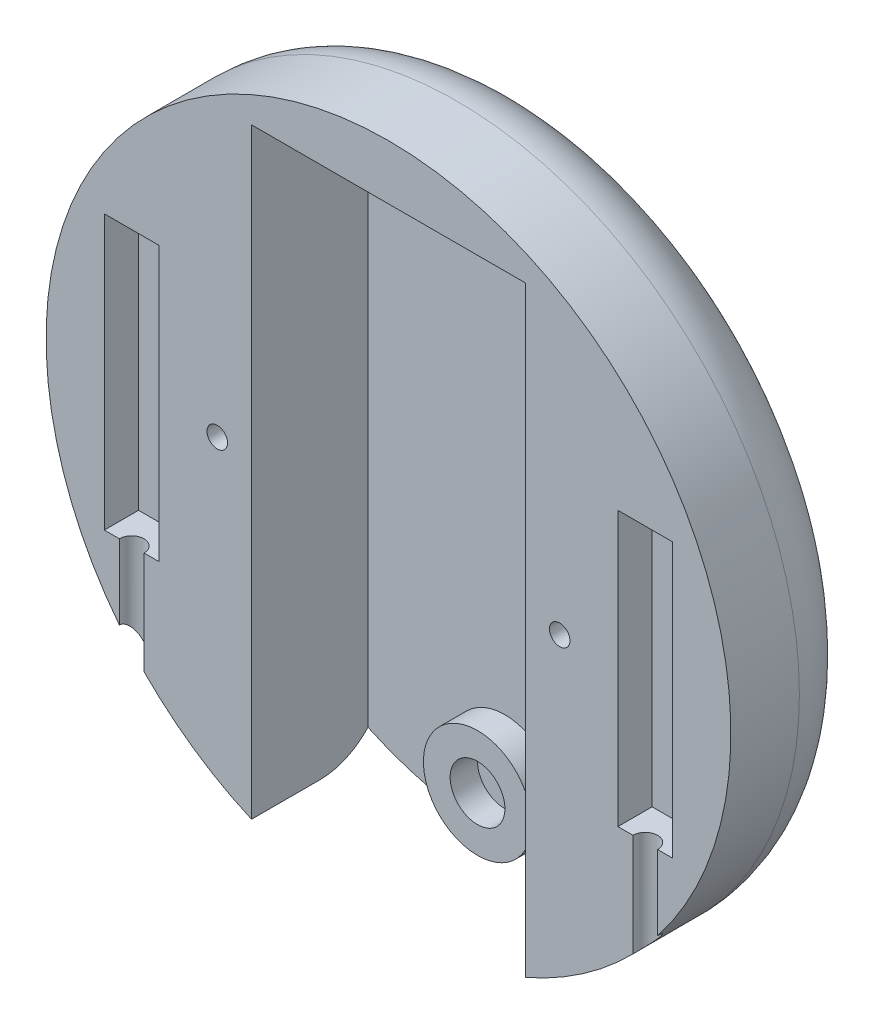
from build123d import *

# Parameters (mm, degrees)
SKETCH_1_R          = 50
EXTRUDE_1_DEPTH     = 20
CUT_EXTRUDE_1_DEPTH = 17
SKETCH_3_R          = 7.9
SKETCH_3_R_2        = 4
EXTRUDE_2_DEPTH     = 4
CUT_EXTRUDE_2_DEPTH = 5
SKETCH_7_R          = 1.8
CUT_EXTRUDE_3_DEPTH = 19
SKETCH_8_W          = 40
SKETCH_8_H          = 17
CUT_EXTRUDE_4_DEPTH = 2
FILLET_1_R          = 10
SKETCH_10_R         = 2.5
CUT_EXTRUDE_5_DEPTH = 10
SKETCH_11_R         = 1.5
CUT_EXTRUDE_6_DEPTH = 10


with BuildPart() as part:
    # 草图1 → 凸台-拉伸1 (new body)
    with BuildSketch(Plane.XY):
        Circle(SKETCH_1_R)
    extrude(amount=EXTRUDE_1_DEPTH)

    # 草图2 → 切除-拉伸1 (cut)
    with BuildSketch(Plane.XY.offset(20)):
        Polygon((-20, -37), (-20, 0), (-20, 40), (20, 40), (20, -58.754478709), (-20, -58.754478709), align=None)
    extrude(amount=-CUT_EXTRUDE_1_DEPTH, mode=Mode.SUBTRACT)

    # 草图3 → 凸台-拉伸2 (add)
    with BuildSketch(Plane.XY.offset(3)):
        with Locations((0, -39)):
            Circle(SKETCH_3_R)
        with Locations((0, -39)):
            Circle(SKETCH_3_R_2, mode=Mode.SUBTRACT)
    extrude(amount=EXTRUDE_2_DEPTH)

    # 草图5 → 切除-拉伸2 (cut)
    with BuildSketch(Plane.XY.offset(20)):
        Polygon((37.5, -20), (33.5, -20), (33.5, 20), (41.5, 20), (41.5, -20), align=None)
    cut_extrude_2 = extrude(amount=-CUT_EXTRUDE_2_DEPTH, mode=Mode.SUBTRACT)

    # 草图7 → 切除-拉伸3 (cut)
    with BuildSketch(Plane(origin=(0, -20, 0), x_dir=(1, 0, 0), z_dir=(0, 1, 0))):
        with Locations((37.5, -20)):
            Circle(SKETCH_7_R)
    cut_extrude_3 = extrude(amount=-CUT_EXTRUDE_3_DEPTH, mode=Mode.SUBTRACT)

    # 镜向1: 切除-拉伸2, 切除-拉伸3 across plane
    add(cut_extrude_2.mirror(Plane(origin=(0, 0, 0), x_dir=(0, 0, 1), z_dir=(1, 0, 0))), mode=Mode.SUBTRACT)
    add(cut_extrude_3.mirror(Plane(origin=(0, 0, 0), x_dir=(0, 0, 1), z_dir=(1, 0, 0))), mode=Mode.SUBTRACT)

    # 草图8 → 切除-拉伸4 (cut)
    with BuildSketch(Plane.XZ.offset(-40)):
        with Locations((0, 11.5)):
            Rectangle(SKETCH_8_W, SKETCH_8_H)
    extrude(amount=-CUT_EXTRUDE_4_DEPTH, mode=Mode.SUBTRACT)

    # 圆角1
    # the kernel refuses this fillet: 10 mm, written as the material it takes off along each edge
    with BuildSketch(Plane(origin=(0, 0, 0), x_dir=(1, 0, 0), z_dir=(0, -1, 0))) as fillet_1_piece_1:
        with BuildLine():
            CenterArc((50 - FILLET_1_R, FILLET_1_R), FILLET_1_R, 270, 90)
            Line((50 - FILLET_1_R, 0), (50, 0))
            Line((50, 0), (50, FILLET_1_R))
        make_face()
    revolve(axis=Axis((0, 0, 0), (0, 0, 1)), mode=Mode.SUBTRACT)

    # 草图10 → 切除-拉伸5 (cut)
    with BuildSketch(Plane(origin=(0, 0, 0), x_dir=(-1, 0, 0), z_dir=(0, 0, -1))):
        with Locations((25, 0)):
            Circle(SKETCH_10_R)
        with Locations((-25, 0)):
            Circle(SKETCH_10_R)
    extrude(amount=-CUT_EXTRUDE_5_DEPTH, mode=Mode.SUBTRACT)

    # 草图11 → 切除-拉伸6 (cut)
    with BuildSketch(Plane(origin=(0, 0, 10), x_dir=(-1, 0, 0), z_dir=(0, 0, -1))):
        with Locations((-25, 0)):
            Circle(SKETCH_11_R)
        with Locations((25, 0)):
            Circle(SKETCH_11_R)
    extrude(amount=-CUT_EXTRUDE_6_DEPTH, mode=Mode.SUBTRACT)


solid = part.part
